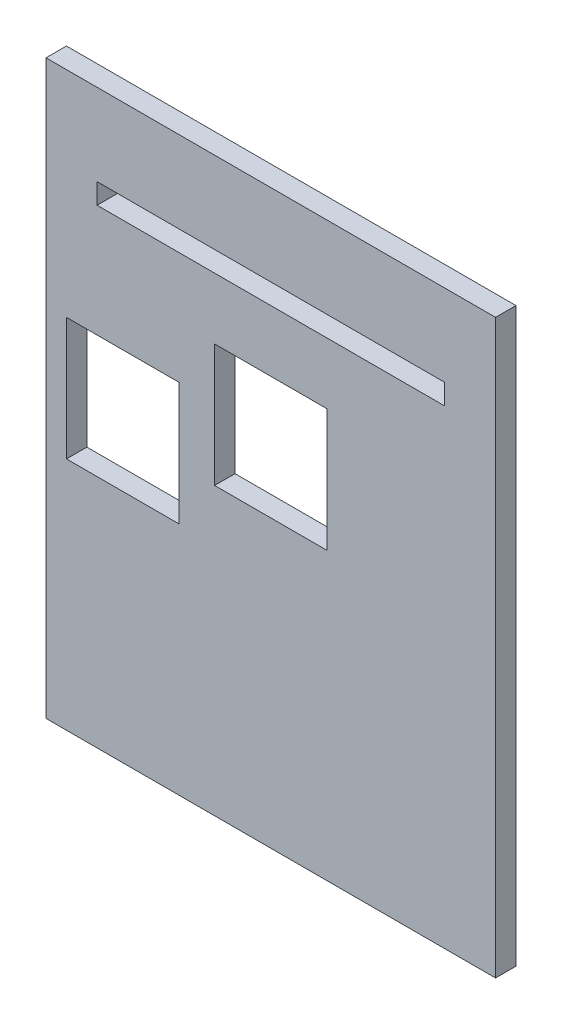
from build123d import *

# Parameters (mm, degrees)
ESQUISSE1_W                  = 220
ESQUISSE1_H                  = 280
BOSS_EXTRU_1_DEPTH           = 10
ESQUISSE2_R                  = 2
ENL_V_MAT_EXTRU_1_DEPTH      = 10
ENL_V_MAT_EXTRU_2_DEPTH      = 357.230262611
ENL_V_MAT_EXTRU_2_DEPTH_BACK = 357.230262611
ESQUISSE3_W                  = 55
ESQUISSE3_H                  = 60
ENL_V_MAT_EXTRU_3_DEPTH      = 357.230262611
ENL_V_MAT_EXTRU_3_DEPTH_BACK = 357.230262611
ESQUISSE5_W                  = 170
ESQUISSE5_H                  = 10


with BuildPart() as part:
    # Esquisse1 → Boss.-Extru.1 (new body)
    with BuildSketch(Plane.XY):
        with Locations((110, 140)):
            Rectangle(ESQUISSE1_W, ESQUISSE1_H)
    extrude(amount=BOSS_EXTRU_1_DEPTH)

    # Esquisse2 → Enlèv. mat.-Extru.1 (cut)
    with BuildSketch(Plane.XZ):
        with Locations((110, 5)):
            Circle(ESQUISSE2_R)
        with Locations((210, 5)):
            Circle(ESQUISSE2_R)
        with Locations((10, 5)):
            Circle(ESQUISSE2_R)
    extrude(amount=-ENL_V_MAT_EXTRU_1_DEPTH, mode=Mode.SUBTRACT)

    # Esquisse3 → Enlèv. mat.-Extru.2 (cut, two sides: drawn at the far end of the back side and taken through both)
    with BuildSketch(Plane.XY.offset(10).offset(-ENL_V_MAT_EXTRU_2_DEPTH_BACK)):
        with Locations((110, 170)):
            Rectangle(ESQUISSE3_W, ESQUISSE3_H)
        with Locations((37.5, 145)):
            Rectangle(ESQUISSE3_W, ESQUISSE3_H)
    extrude(amount=ENL_V_MAT_EXTRU_2_DEPTH + ENL_V_MAT_EXTRU_2_DEPTH_BACK, mode=Mode.SUBTRACT)

    # Esquisse5 → Enlèv. mat.-Extru.3 (cut, two sides: drawn at the far end of the back side and taken through both)
    with BuildSketch(Plane.XY.offset(10).offset(-ENL_V_MAT_EXTRU_3_DEPTH_BACK)):
        with Locations((110, 235)):
            Rectangle(ESQUISSE5_W, ESQUISSE5_H)
    extrude(amount=ENL_V_MAT_EXTRU_3_DEPTH + ENL_V_MAT_EXTRU_3_DEPTH_BACK, mode=Mode.SUBTRACT)


solid = part.part
